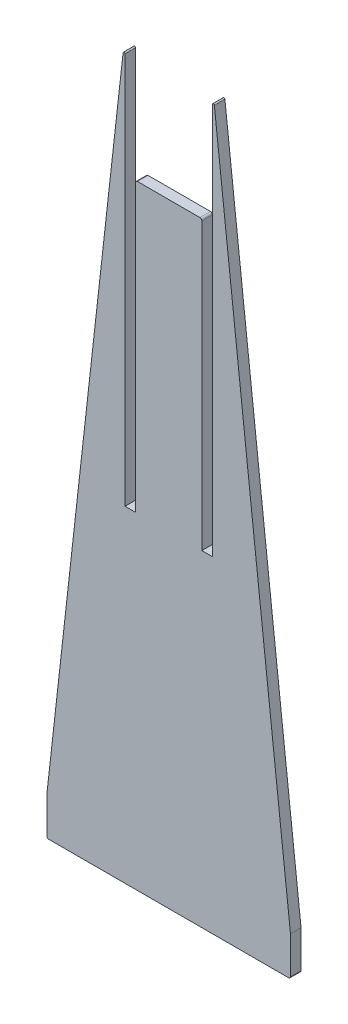
from build123d import *

# Parameters (mm, degrees)
BOSS_EXTRUDE1_DEPTH = 2.7
FILLET1_R           = 1
FILLET2_R           = 0.5


with BuildPart() as part:
    # Sketch3 → Boss-Extrude1 (new, symmetric)
    with BuildSketch(Plane.XY):
        Polygon((-22.35, 376.5), (-62.3, 20), (-62.3, 0), (62.3, 0), (62.3, 20), (22.35, 376.5), (22.35, 167.1), (16.95, 167.1), (16.95, 314.2), (-16.95, 314.2), (-16.95, 167.1), (-22.35, 167.1), align=None)
    extrude(amount=BOSS_EXTRUDE1_DEPTH, both=True)

    # Fillet1
    fillet1_edges = [part.edges().sort_by_distance(p)[0] for p in [
        (-62.3, 0, 0),
        (62.3, 0, 0),
        (16.95, 314.2, 0),
        (-16.95, 314.2, 0),
    ]]
    fillet(fillet1_edges, radius=FILLET1_R)

    # Fillet2
    fillet2_edges = [part.edges().sort_by_distance(p)[0] for p in [
        (-22.35, 376.5, 0),
        (22.35, 376.5, 0),
    ]]
    fillet(fillet2_edges, radius=FILLET2_R)


solid = part.part
